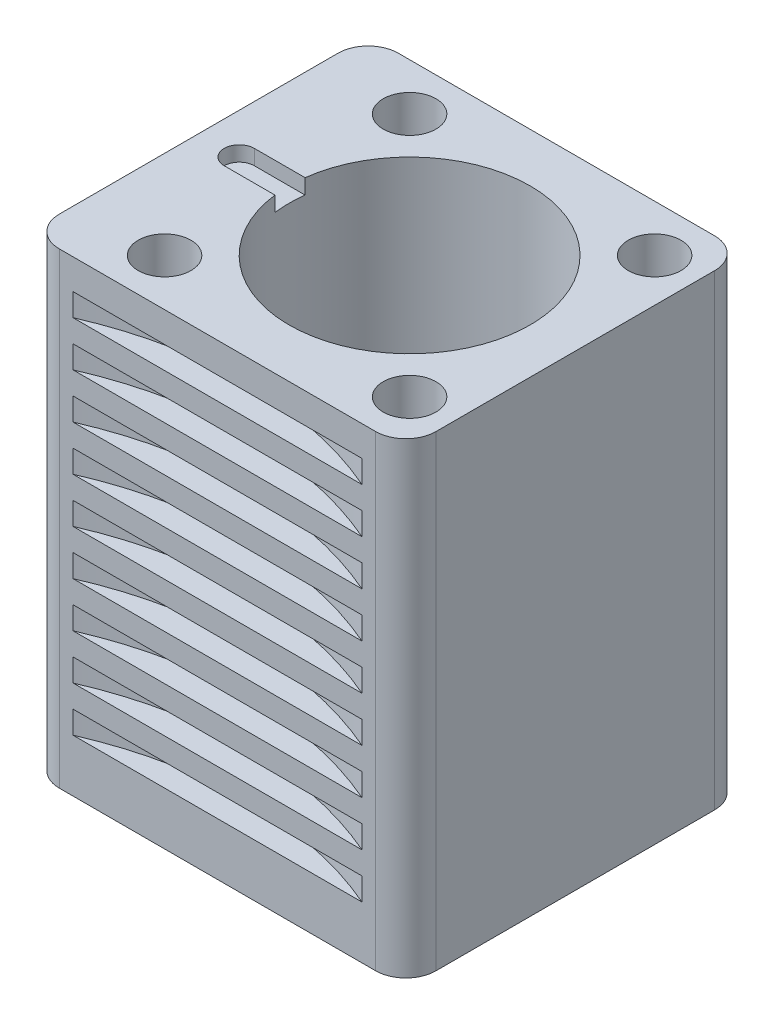
from build123d import *

# Parameters (mm, degrees)
BOSS_EXTRUDE1_DEPTH     = 62
SKETCH2_R               = 18
BOSS_EXTRUDE2_DEPTH     = 2
CUT_EXTRUDE1_DEPTH      = 74.391075752
CUT_EXTRUDE1_DEPTH_BACK = 74.391075752
SKETCH3_R               = 16
CUT_EXTRUDE2_DEPTH      = 2
SKETCH5_R               = 3.5
CUT_EXTRUDE3_DEPTH      = 74.391075752
SKETCH6_W               = 48
SKETCH6_H               = 3
LPATTERN2_COUNT         = 9
LPATTERN2_PITCH         = 6
MIRROR2_COPY_1_SKETCH_W = 48
MIRROR2_COPY_1_SKETCH_H = 3
MIRROR2_COPY_2_SKETCH_W = 48
MIRROR2_COPY_2_SKETCH_H = 3
MIRROR2_COPY_3_SKETCH_W = 48
MIRROR2_COPY_3_SKETCH_H = 3
MIRROR2_COPY_4_SKETCH_W = 48
MIRROR2_COPY_4_SKETCH_H = 3
MIRROR2_COPY_5_SKETCH_W = 48
MIRROR2_COPY_5_SKETCH_H = 3
MIRROR2_COPY_6_SKETCH_W = 48
MIRROR2_COPY_6_SKETCH_H = 3
MIRROR2_COPY_7_SKETCH_W = 48
MIRROR2_COPY_7_SKETCH_H = 3
MIRROR2_COPY_8_SKETCH_W = 48
MIRROR2_COPY_8_SKETCH_H = 3
SKETCH11_W              = 48
SKETCH11_H              = 3
LPATTERN4_COUNT         = 9
LPATTERN4_PITCH         = 6


with BuildPart() as part:
    # Sketch1 → Boss-Extrude1 (new body)
    with BuildSketch(Plane(origin=(0, 0, 0), x_dir=(1, 0, 0), z_dir=(0, 1, 0))):
        with BuildLine():
            Line((18, 22.5), (-24, 22.5))
            ThreePointArc((-24, 22.5), (-26.828427125, 21.328427125), (-28, 18.5))
            Line((-28, 18.5), (-28, -18.5))
            ThreePointArc((-28, -18.5), (-26.828427125, -21.328427125), (-24, -22.5))
            Line((-24, -22.5), (18, -22.5))
            ThreePointArc((18, -22.5), (20.828427125, -21.328427125), (22, -18.5))
            Line((22, -18.5), (22, 18.5))
            ThreePointArc((22, 18.5), (20.828427125, 21.328427125), (18, 22.5))
        make_face()
    extrude(amount=BOSS_EXTRUDE1_DEPTH)

    # Sketch2 → Boss-Extrude2 (add)
    with BuildSketch(Plane.XZ):
        Circle(SKETCH2_R)
    extrude(amount=BOSS_EXTRUDE2_DEPTH)

    # Sketch3 → Cut-Extrude1 (cut, two sides: drawn at the far end of the back side and taken through both)
    with BuildSketch(Plane(origin=(0, -2, 0), x_dir=(-1, 0, 0), z_dir=(0, -1, 0)).offset(-CUT_EXTRUDE1_DEPTH_BACK)):
        Circle(SKETCH3_R)
    extrude(amount=CUT_EXTRUDE1_DEPTH + CUT_EXTRUDE1_DEPTH_BACK, mode=Mode.SUBTRACT)

    # Sketch4 → Cut-Extrude2 (cut)
    with BuildSketch(Plane(origin=(0, 62, 0), x_dir=(1, 0, 0), z_dir=(0, 1, 0))):
        with BuildLine():
            Line((-9.037535931, 2), (-22.61, 2))
            ThreePointArc((-22.61, 2), (-24.61, 0), (-22.61, -2))
            Line((-22.61, -2), (-9.037535931, -2))
            Line((-9.037535931, -2), (-9.037535931, 2))
        make_face()
    extrude(amount=-CUT_EXTRUDE2_DEPTH, mode=Mode.SUBTRACT)

    # Sketch5 → Cut-Extrude3 (cut, through all)
    with BuildSketch(Plane(origin=(0, 62, 0), x_dir=(1, 0, 0), z_dir=(0, 1, 0))):
        with Locations((16.263455967, 16.263455967)):
            Circle(SKETCH5_R)
        with Locations((16.263455967, -16.263455967)):
            Circle(SKETCH5_R)
        with Locations((-16.263455967, -16.263455967)):
            Circle(SKETCH5_R)
        with Locations((-16.263455967, 16.263455967)):
            Circle(SKETCH5_R)
    extrude(amount=-CUT_EXTRUDE3_DEPTH, mode=Mode.SUBTRACT)

    # Sketch6 → Cut-Revolve2 (revolve, cut)
    with BuildSketch(Plane(origin=(-3, 0, 0), x_dir=(0, 0, -1), z_dir=(1, 0, 0))):
        with Locations((-42.5, 56.5)):
            Rectangle(SKETCH6_W, SKETCH6_H)
    cut_revolve2 = revolve(axis=Axis((-3, 58, 66.5), (0, -1, 0)), mode=Mode.SUBTRACT)

    # LPattern2: Cut-Revolve2 ×9
    with Locations(*[(0, -i * LPATTERN2_PITCH, 0) for i in range(1, LPATTERN2_COUNT)]):
        add(cut_revolve2, mode=Mode.SUBTRACT)

    # Mirror2: Cut-Revolve2 across plane
    add(cut_revolve2.mirror(Plane.XY), mode=Mode.SUBTRACT)

    # Mirror2 copy 1 sketch → Mirror2 copy 1 (revolve, cut)
    with BuildSketch(Plane(origin=(-3, -6, 0), x_dir=(0, 0, 1), z_dir=(1, 0, 0))):
        with Locations((-42.5, -56.5)):
            Rectangle(MIRROR2_COPY_1_SKETCH_W, MIRROR2_COPY_1_SKETCH_H)
    revolve(axis=Axis((-3, 52, -66.5), (0, 1, 0)), mode=Mode.SUBTRACT)

    # Mirror2 copy 2 sketch → Mirror2 copy 2 (revolve, cut)
    with BuildSketch(Plane(origin=(-3, -12, 0), x_dir=(0, 0, 1), z_dir=(1, 0, 0))):
        with Locations((-42.5, -56.5)):
            Rectangle(MIRROR2_COPY_2_SKETCH_W, MIRROR2_COPY_2_SKETCH_H)
    revolve(axis=Axis((-3, 46, -66.5), (0, 1, 0)), mode=Mode.SUBTRACT)

    # Mirror2 copy 3 sketch → Mirror2 copy 3 (revolve, cut)
    with BuildSketch(Plane(origin=(-3, -18, 0), x_dir=(0, 0, 1), z_dir=(1, 0, 0))):
        with Locations((-42.5, -56.5)):
            Rectangle(MIRROR2_COPY_3_SKETCH_W, MIRROR2_COPY_3_SKETCH_H)
    revolve(axis=Axis((-3, 40, -66.5), (0, 1, 0)), mode=Mode.SUBTRACT)

    # Mirror2 copy 4 sketch → Mirror2 copy 4 (revolve, cut)
    with BuildSketch(Plane(origin=(-3, -24, 0), x_dir=(0, 0, 1), z_dir=(1, 0, 0))):
        with Locations((-42.5, -56.5)):
            Rectangle(MIRROR2_COPY_4_SKETCH_W, MIRROR2_COPY_4_SKETCH_H)
    revolve(axis=Axis((-3, 34, -66.5), (0, 1, 0)), mode=Mode.SUBTRACT)

    # Mirror2 copy 5 sketch → Mirror2 copy 5 (revolve, cut)
    with BuildSketch(Plane(origin=(-3, -30, 0), x_dir=(0, 0, 1), z_dir=(1, 0, 0))):
        with Locations((-42.5, -56.5)):
            Rectangle(MIRROR2_COPY_5_SKETCH_W, MIRROR2_COPY_5_SKETCH_H)
    revolve(axis=Axis((-3, 28, -66.5), (0, 1, 0)), mode=Mode.SUBTRACT)

    # Mirror2 copy 6 sketch → Mirror2 copy 6 (revolve, cut)
    with BuildSketch(Plane(origin=(-3, -36, 0), x_dir=(0, 0, 1), z_dir=(1, 0, 0))):
        with Locations((-42.5, -56.5)):
            Rectangle(MIRROR2_COPY_6_SKETCH_W, MIRROR2_COPY_6_SKETCH_H)
    revolve(axis=Axis((-3, 22, -66.5), (0, 1, 0)), mode=Mode.SUBTRACT)

    # Mirror2 copy 7 sketch → Mirror2 copy 7 (revolve, cut)
    with BuildSketch(Plane(origin=(-3, -42, 0), x_dir=(0, 0, 1), z_dir=(1, 0, 0))):
        with Locations((-42.5, -56.5)):
            Rectangle(MIRROR2_COPY_7_SKETCH_W, MIRROR2_COPY_7_SKETCH_H)
    revolve(axis=Axis((-3, 16, -66.5), (0, 1, 0)), mode=Mode.SUBTRACT)

    # Mirror2 copy 8 sketch → Mirror2 copy 8 (revolve, cut)
    with BuildSketch(Plane(origin=(-3, -48, 0), x_dir=(0, 0, 1), z_dir=(1, 0, 0))):
        with Locations((-42.5, -56.5)):
            Rectangle(MIRROR2_COPY_8_SKETCH_W, MIRROR2_COPY_8_SKETCH_H)
    revolve(axis=Axis((-3, 10, -66.5), (0, 1, 0)), mode=Mode.SUBTRACT)

    # Sketch11 → Cut-Revolve4 (revolve, cut)
    with BuildSketch(Plane.XY):
        with Locations((-48, 56.5)):
            Rectangle(SKETCH11_W, SKETCH11_H)
    cut_revolve4 = revolve(axis=Axis((-72, 58, 0), (0, -1, 0)), mode=Mode.SUBTRACT)

    # LPattern4: Cut-Revolve4 ×9
    with Locations(*[(0, -i * LPATTERN4_PITCH, 0) for i in range(1, LPATTERN4_COUNT)]):
        add(cut_revolve4, mode=Mode.SUBTRACT)


solid = part.part
